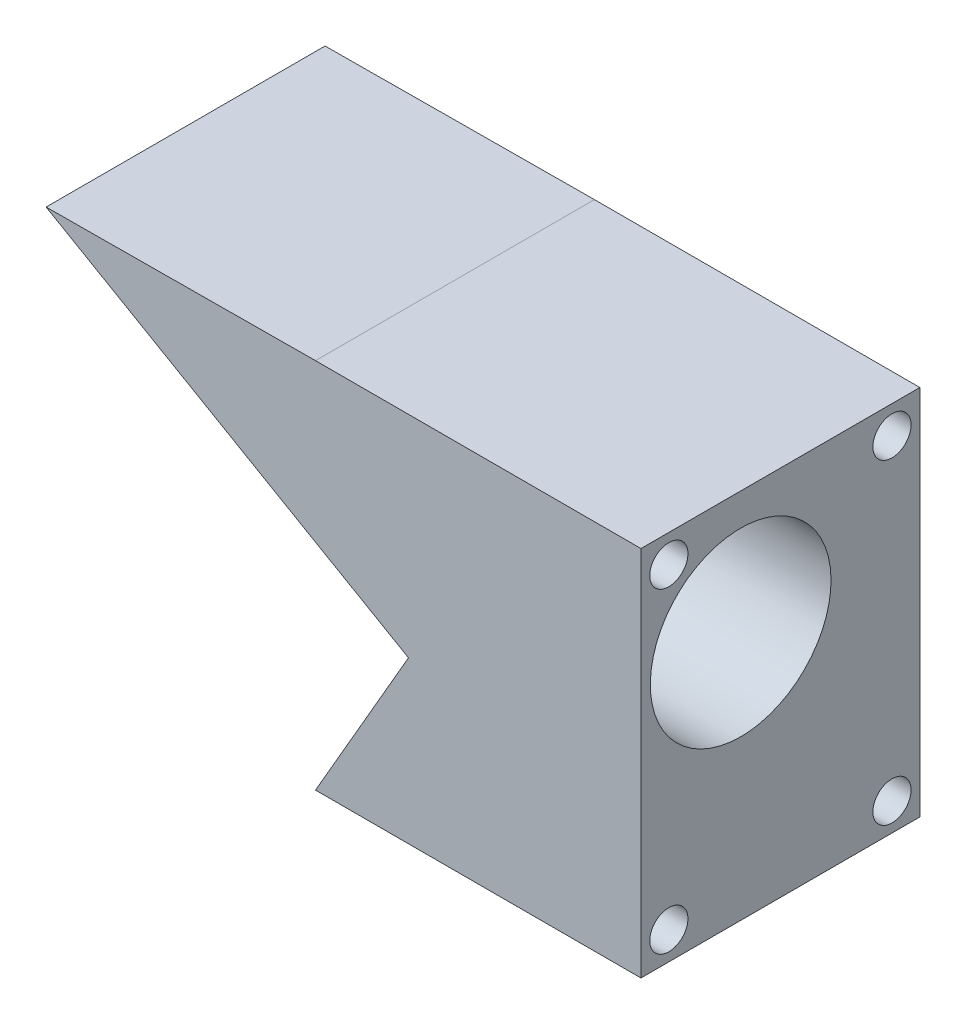
from build123d import *

# Parameters (mm, degrees)
SKETCH2_W                       = 44.45
SKETCH2_H                       = 50.8
BOSS_EXTRUDE2_DEPTH             = 38.1
F_5_0_2055_DIAMETER_HOLE1_D     = 5.2197
F_5_0_2055_DIAMETER_HOLE1_DEPTH = 12.7
F_5_0_2055_DIAMETER_HOLE1_TIP   = 1.568156087
BOSS_EXTRUDE3_DEPTH             = 38.1
CUT_EXTRUDE2_DEPTH              = 91.130758783
CUT_EXTRUDE1_DEPTH              = 94.523620717
CUT_EXTRUDE1_DEPTH_BACK         = 94.523620717
SKETCH3_R                       = 12.342015131


with BuildPart() as part:
    # Sketch2 → Boss-Extrude2 (new body)
    with BuildSketch(Plane.XY):
        with Locations((-18.295089844, 0.954798727)):
            Rectangle(SKETCH2_W, SKETCH2_H)
    extrude(amount=BOSS_EXTRUDE2_DEPTH)

    # #5 (0.2055) Diameter Hole1
    with Locations(Plane(origin=(3.929910156, 22.544798727, 34.29), x_dir=(0, 1, 0), z_dir=(1, 0, 0))):
        with Locations((0, 0), (0, -30.48), (-43.18, -30.48), (-43.18, 0)):
            Hole(F_5_0_2055_DIAMETER_HOLE1_D / 2, depth=F_5_0_2055_DIAMETER_HOLE1_DEPTH)
            with Locations((0, 0, -(F_5_0_2055_DIAMETER_HOLE1_DEPTH + F_5_0_2055_DIAMETER_HOLE1_TIP / 2))):  # 118° drill point
                Cone(0, F_5_0_2055_DIAMETER_HOLE1_D / 2, F_5_0_2055_DIAMETER_HOLE1_TIP, mode=Mode.SUBTRACT)

    # Sketch6 → Boss-Extrude3 (add)
    with BuildSketch(Plane(origin=(0, 0, 0), x_dir=(-1, 0, 0), z_dir=(0, 0, -1))):
        Polygon((40.520089844, 26.354798727), (77.31344167, 26.126843983), (40.520089844, 4.884192402), align=None)
    extrude(amount=-BOSS_EXTRUDE3_DEPTH)

    # Sketch7 → Cut-Extrude2 (cut, through all)
    with BuildSketch(Plane(origin=(0, 0, 0), x_dir=(-1, 0, 0), z_dir=(0, 0, -1))):
        Polygon((40.520089844, 4.884192402), (27.820089844, -2.448156017), (40.520089844, -24.445201273), align=None)
    extrude(amount=-CUT_EXTRUDE2_DEPTH, mode=Mode.SUBTRACT)

    # Sketch3 → Cut-Extrude1 (cut, two sides: drawn at the far end of the back side and taken through both)
    with BuildSketch(Plane(origin=(3.929910156, 0, 0), x_dir=(0, 0, -1), z_dir=(1, 0, 0)).offset(-CUT_EXTRUDE1_DEPTH_BACK)):
        with Locations((-24.476370381, 9.6189509)):
            Circle(SKETCH3_R)
    extrude(amount=CUT_EXTRUDE1_DEPTH + CUT_EXTRUDE1_DEPTH_BACK, mode=Mode.SUBTRACT)


solid = part.part
